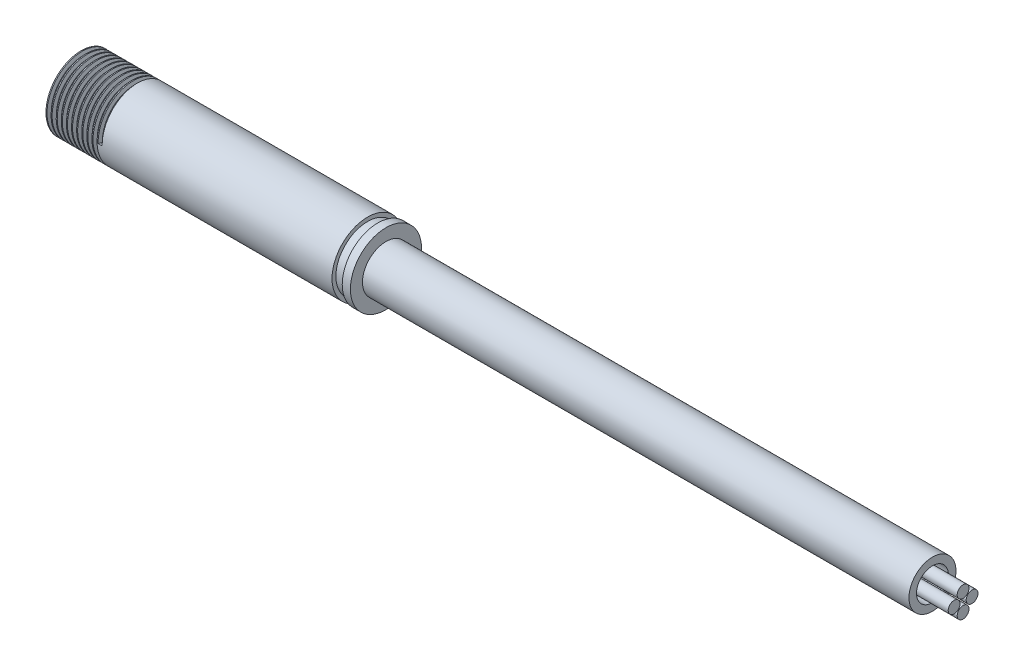
from build123d import *

# Parameters (mm, degrees)
SKETCH1_R           = 3.48
BOSS_EXTRUDE1_DEPTH = 30
SKETCH2_R           = 2.98
SKETCH2_R_2         = 2
CUT_EXTRUDE1_DEPTH  = 2
SKETCH3_R           = 0.748735053
CUT_EXTRUDE2_DEPTH  = 1
SKETCH4_W           = 1.460132148
SKETCH4_H           = 0.767444827
BOSS_EXTRUDE2_DEPTH = 1.5
CIRPATTERN1_COUNT   = 6
CUT_SWEEP2_PITCH    = 0.5
CUT_EXTRUDE3_START  = -28.2
SKETCH7_R           = 4.621237625
SKETCH7_R_2         = 3.1
CUT_EXTRUDE3_DEPTH  = 1
SKETCH8_R           = 2.3
BOSS_EXTRUDE3_DEPTH = 53.5
SKETCH9_R           = 1.561768692
CUT_EXTRUDE4_DEPTH  = 5
SKETCH10_R          = 0.57857426
BOSS_EXTRUDE4_DEPTH = 8


with BuildPart() as part:
    # Sketch1 → Boss-Extrude1 (new body)
    with BuildSketch(Plane(origin=(0, 0, 0), x_dir=(0, 0, -1), z_dir=(1, 0, 0))):
        Circle(SKETCH1_R)
    extrude(amount=BOSS_EXTRUDE1_DEPTH)

    # Sketch2 → Cut-Extrude1 (cut)
    with BuildSketch(Plane.ZY):
        Circle(SKETCH2_R)
        Circle(SKETCH2_R_2, mode=Mode.SUBTRACT)
    extrude(amount=-CUT_EXTRUDE1_DEPTH, mode=Mode.SUBTRACT)

    # Sketch3 → Cut-Extrude2 (cut)
    with BuildSketch(Plane.ZY):
        Circle(SKETCH3_R)
    extrude(amount=-CUT_EXTRUDE2_DEPTH, mode=Mode.SUBTRACT)

    # Sketch4 → Boss-Extrude2 (add)
    with BuildSketch(Plane.ZY.offset(-2)):
        with Locations((0, 2.460257069)):
            Rectangle(SKETCH4_W, SKETCH4_H)
    boss_extrude2 = extrude(amount=BOSS_EXTRUDE2_DEPTH)

    # CirPattern1: Boss-Extrude2 ×6 about axis
    cirpattern1_axis = Axis((0, 0, 0), (1, 0, 0))
    for i in range(1, CIRPATTERN1_COUNT):
        add(boss_extrude2.rotate(cirpattern1_axis, i * 360 / CIRPATTERN1_COUNT))

    # Cut-Sweep2: arcs per turn and ends read off the stored shape
    # Cut-Sweep2: the profile of Sketch6 profile screwed along a right-hand helix through 12 turns, 6 arcs to a turn; built about Z, then put on its axis
    cut_sweep2_z = Axis((0, 0, 0), (0, 0, 1))
    cut_sweep2_corners = [(3.18, 0, -0.581318593), (3.18, 0, -0.418681407), (3.4803, 0, -0.299881319), (3.4803, 0, -0.700118681)]
    with BuildLine(mode=Mode.PRIVATE) as cut_sweep2_profile:
        Line(cut_sweep2_corners[0], cut_sweep2_corners[1])
        Line(cut_sweep2_corners[1], cut_sweep2_corners[2])
        Line(cut_sweep2_corners[2], cut_sweep2_corners[3])
        Line(cut_sweep2_corners[3], cut_sweep2_corners[0])
    cut_sweep2_cap = Face(cut_sweep2_profile.wire())
    cut_sweep2_turn_angles = [0, 30, 60, 90, 120, 150, 180, 210, 240, 270, 300, 330, 360]
    cut_sweep2_turn_weights = [1, 0.8660254037844387, 1, 0.8660254037844387, 1, 0.8660254037844387, 1, 0.8660254037844387, 1, 0.8660254037844387, 1, 0.8660254037844387, 1]
    cut_sweep2_turn_rails = [Edge.make_bspline([Vector(p[0], p[1], 0).rotate(cut_sweep2_z, cut_sweep2_turn_angles[k]) / cut_sweep2_turn_weights[k] + Vector(0, 0, p[2] + CUT_SWEEP2_PITCH * cut_sweep2_turn_angles[k] / 360) for k in range(13)], [0, 0, 0, 1, 1, 2, 2, 3, 3, 4, 4, 5, 5, 6, 6, 6], 2, cut_sweep2_turn_weights) for p in cut_sweep2_corners]
    cut_sweep2_turn_sides = [Face.make_surface_from_curves(cut_sweep2_turn_rails[p[0]], cut_sweep2_turn_rails[p[1]]) for p in [(0, 1), (1, 2), (2, 3), (3, 0)]]
    cut_sweep2 = Plane(origin=(0, 0, 0), x_dir=(0, 0, 1), z_dir=(1, 0, 0)) * Solid(Shell([*[p.moved(Location((0, 0, CUT_SWEEP2_PITCH * i))) for i in range(12) for p in cut_sweep2_turn_sides], cut_sweep2_cap, cut_sweep2_cap.rotate(cut_sweep2_z, 4320).moved(Location((0, 0, CUT_SWEEP2_PITCH * 4320 / 360)))]))
    add(cut_sweep2, mode=Mode.SUBTRACT)

    # Sketch7 → Cut-Extrude3 (cut)
    with BuildSketch(Plane.ZY.offset(CUT_EXTRUDE3_START)):
        Circle(SKETCH7_R)
        Circle(SKETCH7_R_2, mode=Mode.SUBTRACT)
    extrude(amount=-CUT_EXTRUDE3_DEPTH, mode=Mode.SUBTRACT)

    # Sketch8 → Boss-Extrude3 (add)
    with BuildSketch(Plane(origin=(30, 0, 0), x_dir=(0, 0, -1), z_dir=(1, 0, 0))):
        Circle(SKETCH8_R)
    extrude(amount=BOSS_EXTRUDE3_DEPTH)

    # Sketch9 → Cut-Extrude4 (cut)
    with BuildSketch(Plane(origin=(83.5, 0, 0), x_dir=(0, 0, -1), z_dir=(1, 0, 0))):
        Circle(SKETCH9_R)
    extrude(amount=-CUT_EXTRUDE4_DEPTH, mode=Mode.SUBTRACT)

    # Sketch10 → Boss-Extrude4 (add)
    with BuildSketch(Plane(origin=(78.5, 0, 0), x_dir=(0, 0, -1), z_dir=(1, 0, 0))):
        with Locations((0, 0.879823693)):
            Circle(SKETCH10_R)
        with Locations((0.879823693, 0)):
            Circle(SKETCH10_R)
        with Locations((0, -0.879823693)):
            Circle(SKETCH10_R)
        with Locations((-0.879823693, 0)):
            Circle(SKETCH10_R)
    extrude(amount=BOSS_EXTRUDE4_DEPTH)


solid = part.part
